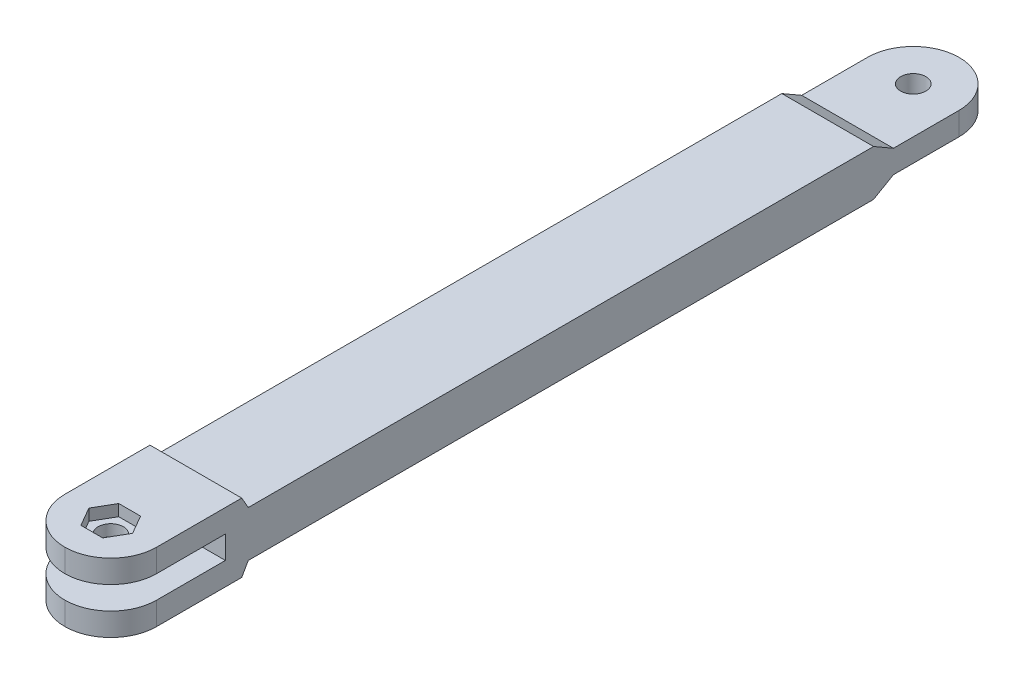
from build123d import *

# Parameters (mm, degrees)
BOSS_EXTRUDE1_DEPTH      = 75
BOSS_EXTRUDE1_DEPTH_BACK = 75
SKETCH1_W                = 20
SKETCH1_H                = 10
SKETCH3_W                = 20
SKETCH3_H                = 5
BOSS_EXTRUDE2_DEPTH      = 20
FILLET1_R                = 10
SKETCH5_W                = 20
SKETCH5_H                = 5
BOSS_EXTRUDE3_DEPTH      = 25
CHAMFER1_SIZE            = 5
CHAMFER1_SIZE_2          = 8.660254038
FILLET2_R                = 10
CUT_EXTRUDE1_DEPTH       = 101.995049384
CUT_EXTRUDE1_DEPTH_BACK  = 101.995049384
SKETCH4_R                = 2.75
CUT_EXTRUDE2_DEPTH       = 102.612007165
CUT_EXTRUDE2_DEPTH_BACK  = 2.5


# Some blends are built 0.0001 mm under size
with BuildPart() as part:
    # Sketch1 → Boss-Extrude1 (new, two sides: drawn at the far end of the back side and taken through both)
    with BuildSketch(Plane.XY.offset(-BOSS_EXTRUDE1_DEPTH_BACK)):
        Rectangle(SKETCH1_W, SKETCH1_H)
    extrude(amount=BOSS_EXTRUDE1_DEPTH + BOSS_EXTRUDE1_DEPTH_BACK)

    # Sketch3 → Boss-Extrude2 (add)
    with BuildSketch(Plane(origin=(0, 0, -75), x_dir=(-1, 0, 0), z_dir=(0, 0, -1))):
        Rectangle(SKETCH3_W, SKETCH3_H)
    extrude(amount=BOSS_EXTRUDE2_DEPTH)

    # Fillet1
    fillet1_edges = [part.edges().sort_by_distance(p)[0] for p in [
        (-10, 0, -95),
        (10, 0, -95),
    ]]
    fillet(fillet1_edges, radius=FILLET1_R - 0.0001)  # a hair under: the kernel refuses the full size

    # Sketch5 → Boss-Extrude3 (add)
    with BuildSketch(Plane.XY.offset(75)):
        with Locations((0, 5)):
            Rectangle(SKETCH5_W, SKETCH5_H)
        with Locations((0, -5)):
            Rectangle(SKETCH5_W, SKETCH5_H)
    extrude(amount=BOSS_EXTRUDE3_DEPTH)

    # Chamfer1
    # the kernel refuses this chamfer: 8.660254038, 5 mm, written as the material it adds along each edge
    with BuildSketch(Plane(origin=(10, 5, 75), x_dir=(0, -0.05789386240267149, -0.9983227437537926), z_dir=(-1, 0, 0))) as chamfer1_piece_1_section:
        Polygon((CHAMFER1_SIZE * 0.998322743754, -CHAMFER1_SIZE * 0.0578938624027), (-CHAMFER1_SIZE_2 * 0.0578938624016, -CHAMFER1_SIZE_2 * 0.998322743736), (0, 0), align=None)
    chamfer1_piece_1 = extrude(amount=20, mode=Mode.PRIVATE)
    chamfer1_piece_1 = split(chamfer1_piece_1, bisect_by=Plane(origin=(0, 7.5, 72.827003025), z_dir=(0, -1, 0)), keep=Keep.TOP, mode=Mode.PRIVATE)
    add(chamfer1_piece_1)
    with BuildSketch(Plane(origin=(-10, -5, 75), x_dir=(0, 0.05789386240267149, -0.9983227437537926), z_dir=(1, 0, 0))) as chamfer1_piece_2_section:
        Polygon((CHAMFER1_SIZE * 0.998322743754, -CHAMFER1_SIZE * 0.0578938624027), (-CHAMFER1_SIZE_2 * 0.0578938624016, -CHAMFER1_SIZE_2 * 0.998322743736), (0, 0), align=None)
    chamfer1_piece_2 = extrude(amount=20, mode=Mode.PRIVATE)
    chamfer1_piece_2 = split(chamfer1_piece_2, bisect_by=Plane(origin=(0, -7.5, 72.827003025), z_dir=(0, 1, 0)), keep=Keep.TOP, mode=Mode.PRIVATE)
    add(chamfer1_piece_2)
    # the kernel refuses this chamfer: 8.660254038, 5 mm, written as the material it takes off along each edge
    with BuildSketch(Plane(origin=(32.404819853, 5, -75), x_dir=(0, 0.019326765612700594, 0.999813220622208), z_dir=(-1, 0, 0))) as chamfer1_2_piece_1_section:
        Polygon((CHAMFER1_SIZE_2 * 0.999813220604, -CHAMFER1_SIZE_2 * 0.0193267656124), (-CHAMFER1_SIZE * 0.0193267656127, -CHAMFER1_SIZE * 0.999813220622), (0, 0), align=None)
    chamfer1_2_piece_1 = extrude(amount=64.809639706, mode=Mode.PRIVATE)
    chamfer1_2_piece_1 = split(chamfer1_2_piece_1, bisect_by=Plane(origin=(0, 2.5, -71.539331058), z_dir=(0, 1, 0)), keep=Keep.TOP, mode=Mode.PRIVATE)
    add(chamfer1_2_piece_1, mode=Mode.SUBTRACT)
    with BuildSketch(Plane(origin=(-32.404819853, -5, -75), x_dir=(0, 0.9983227437537926, -0.05789386240267045), z_dir=(1, 0, 0))) as chamfer1_2_piece_2_section:
        Polygon((CHAMFER1_SIZE * 0.998322743754, CHAMFER1_SIZE * 0.0578938624027), (-CHAMFER1_SIZE_2 * 0.0578938624016, CHAMFER1_SIZE_2 * 0.998322743736), (0, 0), align=None)
    chamfer1_2_piece_2 = extrude(amount=64.809639706, mode=Mode.PRIVATE)
    chamfer1_2_piece_2 = split(chamfer1_2_piece_2, bisect_by=Plane(origin=(0, -2.5, -71.539331058), z_dir=(0, -1, 0)), keep=Keep.TOP, mode=Mode.PRIVATE)
    add(chamfer1_2_piece_2, mode=Mode.SUBTRACT)

    # Fillet2
    fillet2_edges = [part.edges().sort_by_distance(p)[0] for p in [
        (-10, -5, 100),
        (-10, 5, 100),
        (10, -5, 100),
        (10, 5, 100),
    ]]
    fillet(fillet2_edges, radius=FILLET2_R - 0.0001)  # a hair under: the kernel refuses the full size

    # Sketch4 → Cut-Extrude1 (cut, two sides: drawn at the far end of the back side and taken through both)
    with BuildSketch(Plane(origin=(0, 2.5, 0), x_dir=(1, 0, 0), z_dir=(0, 1, 0)).offset(-CUT_EXTRUDE1_DEPTH_BACK)):
        with Locations(Location((0, 85, 0), (0, 0, 270))):
            Circle(SKETCH4_R)
        with Locations(Location((0, -90, 0), (0, 0, 270))):
            Circle(SKETCH4_R)
    extrude(amount=CUT_EXTRUDE1_DEPTH + CUT_EXTRUDE1_DEPTH_BACK, mode=Mode.SUBTRACT)

    # Sketch6 → Cut-Extrude2 (cut, two sides: drawn at the far end of the back side and taken through both)
    with BuildSketch(Plane(origin=(0, 7.5, 0), x_dir=(1, 0, 0), z_dir=(0, 1, 0)).offset(-CUT_EXTRUDE2_DEPTH_BACK)):
        Polygon((-2.38156986, -85.875), (-4.763139721, -90), (-2.38156986, -94.125), (2.38156986, -94.125), (4.763139721, -90), (2.38156986, -85.875), align=None)
    extrude(amount=CUT_EXTRUDE2_DEPTH + CUT_EXTRUDE2_DEPTH_BACK, mode=Mode.SUBTRACT)


solid = part.part
